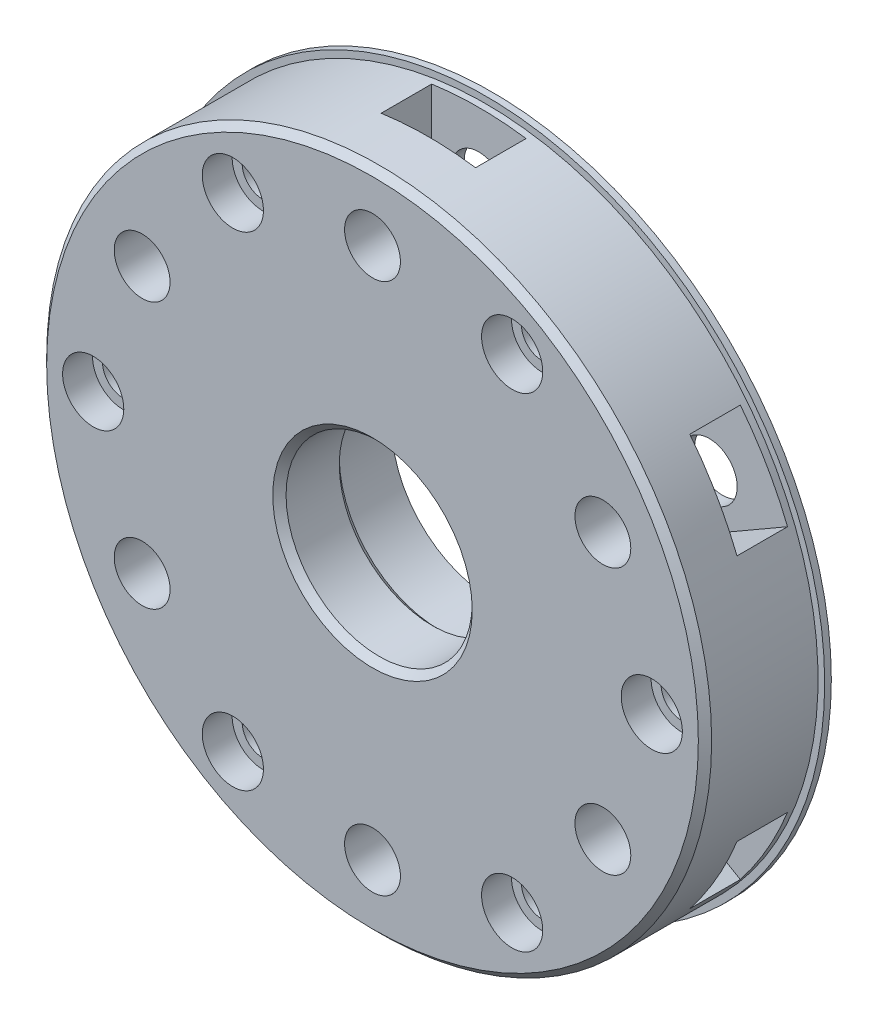
from build123d import *

# Parameters (mm, degrees)
OUTPUT_MASTER_SKETCH_R  = 25
BOSS_EXTRUDE1_DEPTH     = 9
SKETCH4_R               = 3.05
CUT_EXTRUDE1_DEPTH      = 4
SKETCH5_R               = 25.5
SKETCH5_R_2             = 25
BOSS_EXTRUDE2_DEPTH     = 0.5
SKETCH6_R               = 1.55
CUT_EXTRUDE2_DEPTH      = 38.16853508
SKETCH7_R               = 2.3
CUT_EXTRUDE3_DEPTH      = 2.25
CHAMFER1_SIZE           = 0.5
SKETCH8_R               = 7
CUT_EXTRUDE4_DEPTH      = 10
SKETCH9_R               = 7.55
CUT_EXTRUDE5_DEPTH      = 4
CHAMFER2_SIZE           = 0.5
SKETCH10_R              = 2.1
M4_THRU_DEPTH           = 38.16853508
CHAMFER3_SIZE           = 0.5
M4_START                = -8
M4_HEXNUT_CUT_DEPTH     = 3.8
SKETCH12_W              = 7.1
SKETCH12_H              = 3.8
M4_HEXNUT_SLOT_DEPTH    = 55.701131961
M4_HEXNUT_PATTERN_COUNT = 6


with BuildPart() as part:
    # Output Master Sketch → Boss-Extrude1 (new body)
    with BuildSketch(Plane.XY):
        Circle(OUTPUT_MASTER_SKETCH_R)
    extrude(amount=BOSS_EXTRUDE1_DEPTH)

    # Sketch4 → Cut-Extrude1 (cut)
    with BuildSketch(Plane.XY):
        with Locations((21, 0)):
            Circle(SKETCH4_R)
        with Locations((10.5, -18.186533479)):
            Circle(SKETCH4_R)
        with Locations((-10.5, -18.186533479)):
            Circle(SKETCH4_R)
        with Locations((-21, 0)):
            Circle(SKETCH4_R)
        with Locations((-10.5, 18.186533479)):
            Circle(SKETCH4_R)
        with Locations((10.5, 18.186533479)):
            Circle(SKETCH4_R)
    extrude(amount=CUT_EXTRUDE1_DEPTH, mode=Mode.SUBTRACT)

    # Sketch5 → Boss-Extrude2 (add)
    with BuildSketch(Plane(origin=(0, 0, 0), x_dir=(-1, 0, 0), z_dir=(0, 0, -1))):
        Circle(SKETCH5_R)
        Circle(SKETCH5_R_2, mode=Mode.SUBTRACT)
    extrude(amount=-BOSS_EXTRUDE2_DEPTH)

    # Sketch6 → Cut-Extrude2 (cut, through all)
    with BuildSketch(Plane(origin=(0, 0, 0), x_dir=(-1, 0, 0), z_dir=(0, 0, -1))):
        with Locations((-21, 0)):
            Circle(SKETCH6_R)
        with Locations((-10.5, 18.186533479)):
            Circle(SKETCH6_R)
        with Locations((10.5, 18.186533479)):
            Circle(SKETCH6_R)
        with Locations((21, 0)):
            Circle(SKETCH6_R)
        with Locations((10.5, -18.186533479)):
            Circle(SKETCH6_R)
        with Locations((-10.5, -18.186533479)):
            Circle(SKETCH6_R)
    extrude(amount=-CUT_EXTRUDE2_DEPTH, mode=Mode.SUBTRACT)

    # Sketch7 → Cut-Extrude3 (cut)
    with BuildSketch(Plane.XY.offset(9)):
        with Locations((-21, 0)):
            Circle(SKETCH7_R)
        with Locations((-10.5, 18.186533479)):
            Circle(SKETCH7_R)
        with Locations((10.5, 18.186533479)):
            Circle(SKETCH7_R)
        with Locations((21, 0)):
            Circle(SKETCH7_R)
        with Locations((10.5, -18.186533479)):
            Circle(SKETCH7_R)
        with Locations((-10.5, -18.186533479)):
            Circle(SKETCH7_R)
    extrude(amount=-CUT_EXTRUDE3_DEPTH, mode=Mode.SUBTRACT)

    # Chamfer1
    chamfer1_edges = [part.edges().sort_by_distance(p)[0] for p in [
        (-25, 0, 9),
    ]]
    chamfer(chamfer1_edges, length=CHAMFER1_SIZE)

    # Sketch8 → Cut-Extrude4 (cut)
    with BuildSketch(Plane(origin=(0, 0, 0), x_dir=(-1, 0, 0), z_dir=(0, 0, -1))):
        Circle(SKETCH8_R)
    extrude(amount=-CUT_EXTRUDE4_DEPTH, mode=Mode.SUBTRACT)

    # Sketch9 → Cut-Extrude5 (cut)
    with BuildSketch(Plane(origin=(0, 0, 0), x_dir=(-1, 0, 0), z_dir=(0, 0, -1))):
        Circle(SKETCH9_R)
    extrude(amount=-CUT_EXTRUDE5_DEPTH, mode=Mode.SUBTRACT)

    # Chamfer2
    chamfer2_edges = [part.edges().sort_by_distance(p)[0] for p in [
        (7, 0, 4),
    ]]
    chamfer(chamfer2_edges, length=CHAMFER2_SIZE)

    # Sketch10 → M4 Thru (cut, through all)
    with BuildSketch(Plane.XY.offset(9)):
        with Locations((0, 20)):
            Circle(SKETCH10_R)
        with Locations((17.320508076, 10)):
            Circle(SKETCH10_R)
        with Locations((17.320508076, -10)):
            Circle(SKETCH10_R)
        with Locations((0, -20)):
            Circle(SKETCH10_R)
        with Locations((-17.320508076, -10)):
            Circle(SKETCH10_R)
        with Locations((-17.320508076, 10)):
            Circle(SKETCH10_R)
    extrude(amount=-M4_THRU_DEPTH, mode=Mode.SUBTRACT)

    # Chamfer3
    chamfer3_edges = [part.edges().sort_by_distance(p)[0] for p in [
        (7, 0, 9),
    ]]
    chamfer(chamfer3_edges, length=CHAMFER3_SIZE)

    # Sketch11 → M4 Hexnut Cut (cut)
    with BuildSketch(Plane.XY.offset(9).offset(M4_START)):
        Polygon((0, 24.099186911), (-3.55, 22.049593456), (-3.55, 17.950406544), (0, 15.900813089), (3.55, 17.950406544), (3.55, 22.049593456), align=None)
    m4_hexnut_cut = extrude(amount=M4_HEXNUT_CUT_DEPTH, mode=Mode.SUBTRACT)

    # Sketch12 → M4 Hexnut Slot (cut, through all)
    with BuildSketch(Plane(origin=(0, 22.049593456, 0), x_dir=(1, 0, 0), z_dir=(0, 1, 0))):
        with Locations((0, -2.9)):
            Rectangle(SKETCH12_W, SKETCH12_H)
    m4_hexnut_slot = extrude(amount=M4_HEXNUT_SLOT_DEPTH, mode=Mode.SUBTRACT)

    # M4 Hexnut Pattern: M4 Hexnut Cut, M4 Hexnut Slot ×6 about axis
    m4_hexnut_pattern_axis = Axis((0, 0, 10), (0, 0, -1))
    add([m4_hexnut_cut.rotate(m4_hexnut_pattern_axis, i * 360 / M4_HEXNUT_PATTERN_COUNT) for i in range(1, M4_HEXNUT_PATTERN_COUNT)], mode=Mode.SUBTRACT)
    add([m4_hexnut_slot.rotate(m4_hexnut_pattern_axis, i * 360 / M4_HEXNUT_PATTERN_COUNT) for i in range(1, M4_HEXNUT_PATTERN_COUNT)], mode=Mode.SUBTRACT)


solid = part.part
